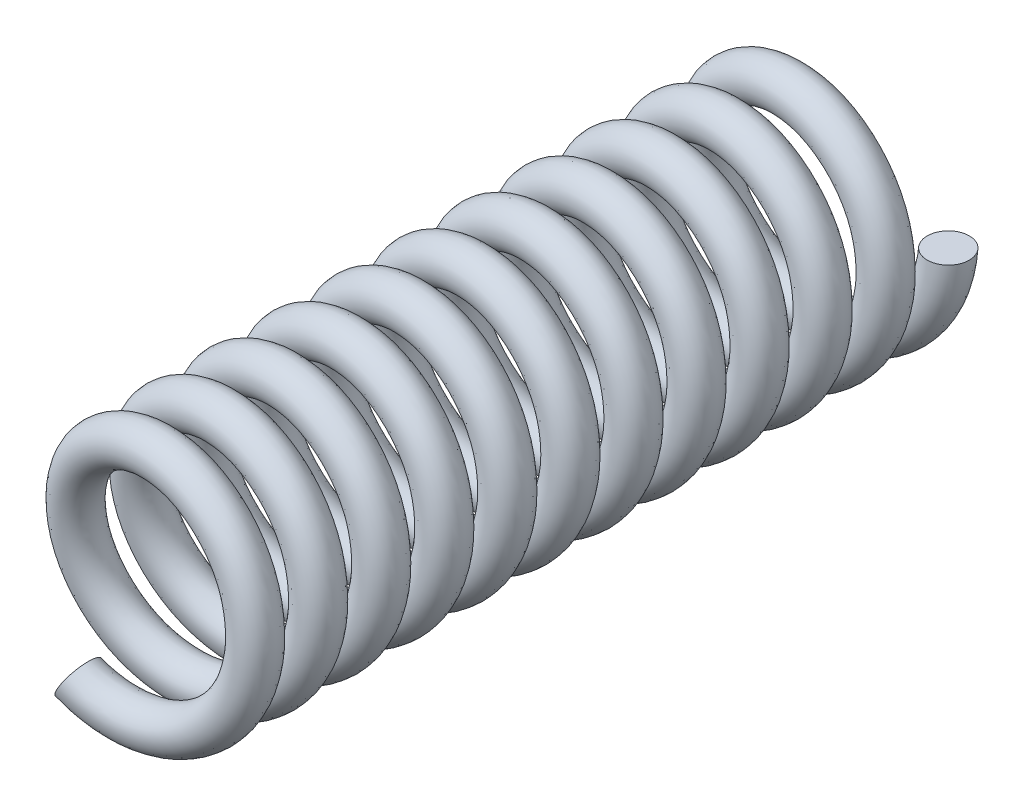
from build123d import *

# Parameters (mm, degrees)
SWEEP1_PITCH  = 1.5
SWEEP1_HEIGHT = 16.995
SWEEP1_RADIUS = 2.5
SKETCH2_R     = 0.5


with BuildPart() as part:
    # Sweep1: sweep along a helix
    with BuildLine() as sweep1_path:
        Helix(SWEEP1_PITCH, SWEEP1_HEIGHT, SWEEP1_RADIUS, center=(0, 0, 0), direction=(0, 0, 1), lefthand=True)
    # Sketch2 → Sweep1 (sweep)
    with BuildSketch(Plane(origin=(0, 0, 0), x_dir=(1, 0, 0), z_dir=(0, 1, 0))):
        with Locations((2.5, 0)):
            Circle(SKETCH2_R)
    sweep(path=sweep1_path.line, is_frenet=True)


solid = part.part
